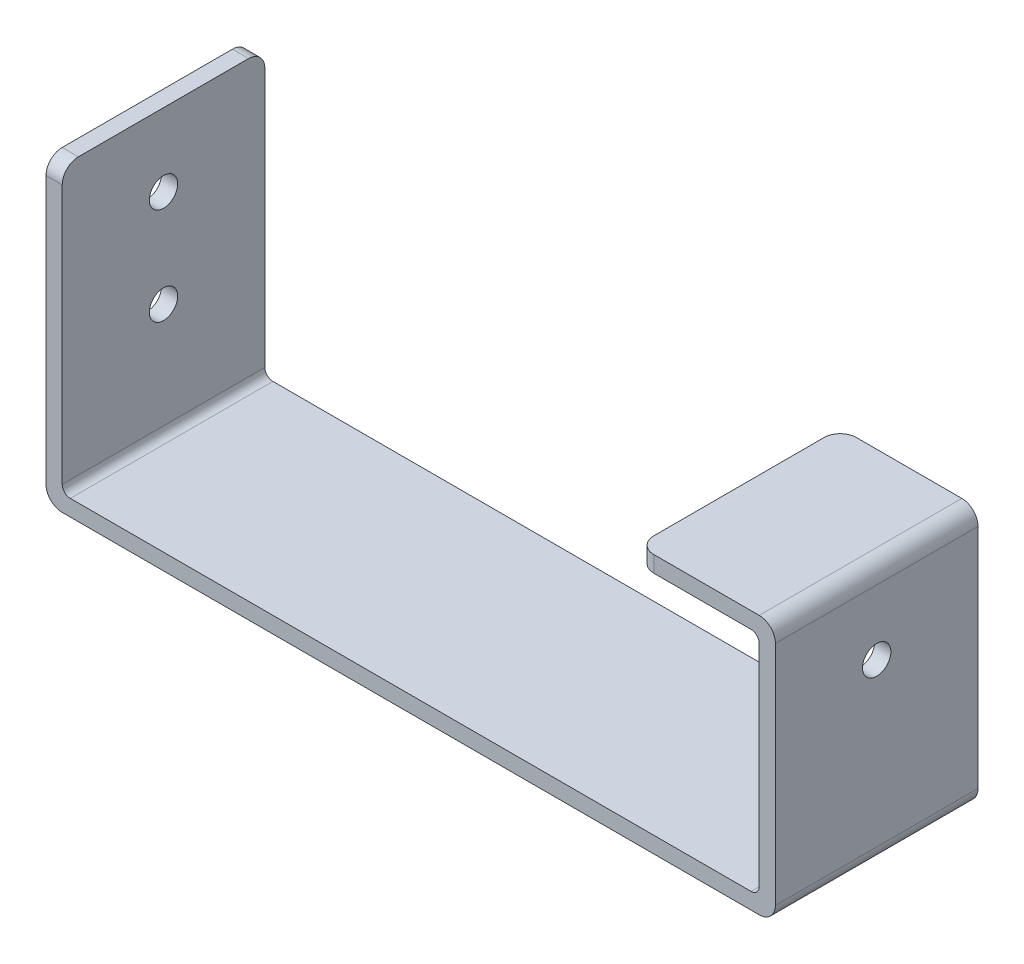
from build123d import *

# Parameters (mm, degrees)
EXTRU_MINCE1_DEPTH      = 25
CONG_1_R                = 1
CONG_2_R                = 1
CONG_3_R                = 2
CONG_4_R                = 2
ESQUISSE2_R             = 1.75
ENL_V_MAT_EXTRU_1_DEPTH = 2
ESQUISSE3_R             = 1.75
ENL_V_MAT_EXTRU_2_DEPTH = 2
CONG_11_R               = 2
CONG_12_R               = 2
CONG_13_R               = 2
CONG_14_R               = 1
CONG_15_R               = 2
CONG_16_R               = 2


with BuildPart() as part:
    # Esquisse1 → Extru.-Mince1 (new body)
    with BuildSketch(Plane.XY):
        Polygon((0, 35), (0, 0), (86, 0), (86, 28), (71, 28), (71, 30), (88, 30), (88, -2), (-2, -2), (-2, 35), align=None)
    extrude(amount=EXTRU_MINCE1_DEPTH)

    # Congé1
    cong_1_edges = [part.edges().sort_by_distance(p)[0] for p in [
        (0, 0, 12.5),
    ]]
    fillet(cong_1_edges, radius=CONG_1_R)

    # Congé2
    cong_2_edges = [part.edges().sort_by_distance(p)[0] for p in [
        (86, 0, 12.5),
    ]]
    fillet(cong_2_edges, radius=CONG_2_R)

    # Congé3
    cong_3_edges = [part.edges().sort_by_distance(p)[0] for p in [
        (88, -2, 12.5),
    ]]
    fillet(cong_3_edges, radius=CONG_3_R)

    # Congé4
    cong_4_edges = [part.edges().sort_by_distance(p)[0] for p in [
        (-2, -2, 12.5),
    ]]
    fillet(cong_4_edges, radius=CONG_4_R)

    # Esquisse2 → Enlèv. mat.-Extru.1 (cut)
    with BuildSketch(Plane.ZY.offset(2)):
        with Locations((12.5, 26)):
            Circle(ESQUISSE2_R)
        with Locations((12.5, 14)):
            Circle(ESQUISSE2_R)
    extrude(amount=-ENL_V_MAT_EXTRU_1_DEPTH, mode=Mode.SUBTRACT)

    # Esquisse3 → Enlèv. mat.-Extru.2 (cut)
    with BuildSketch(Plane(origin=(88, 0, 0), x_dir=(0, 0, -1), z_dir=(1, 0, 0))):
        with Locations((-12.5, 20)):
            Circle(ESQUISSE3_R)
    extrude(amount=-ENL_V_MAT_EXTRU_2_DEPTH, mode=Mode.SUBTRACT)

    # Congé11
    cong_11_edges = [part.edges().sort_by_distance(p)[0] for p in [
        (88, 30, 12.5),
    ]]
    fillet(cong_11_edges, radius=CONG_11_R)

    # Congé12
    cong_12_edges = [part.edges().sort_by_distance(p)[0] for p in [
        (71, 29, 0),
    ]]
    fillet(cong_12_edges, radius=CONG_12_R)

    # Congé13
    cong_13_edges = [part.edges().sort_by_distance(p)[0] for p in [
        (71, 29, 25),
    ]]
    fillet(cong_13_edges, radius=CONG_13_R)

    # Congé14
    cong_14_edges = [part.edges().sort_by_distance(p)[0] for p in [
        (86, 28, 12.5),
    ]]
    fillet(cong_14_edges, radius=CONG_14_R)

    # Congé15
    cong_15_edges = [part.edges().sort_by_distance(p)[0] for p in [
        (-1, 35, 0),
    ]]
    fillet(cong_15_edges, radius=CONG_15_R)

    # Congé16
    cong_16_edges = [part.edges().sort_by_distance(p)[0] for p in [
        (-1, 35, 25),
    ]]
    fillet(cong_16_edges, radius=CONG_16_R)


solid = part.part
